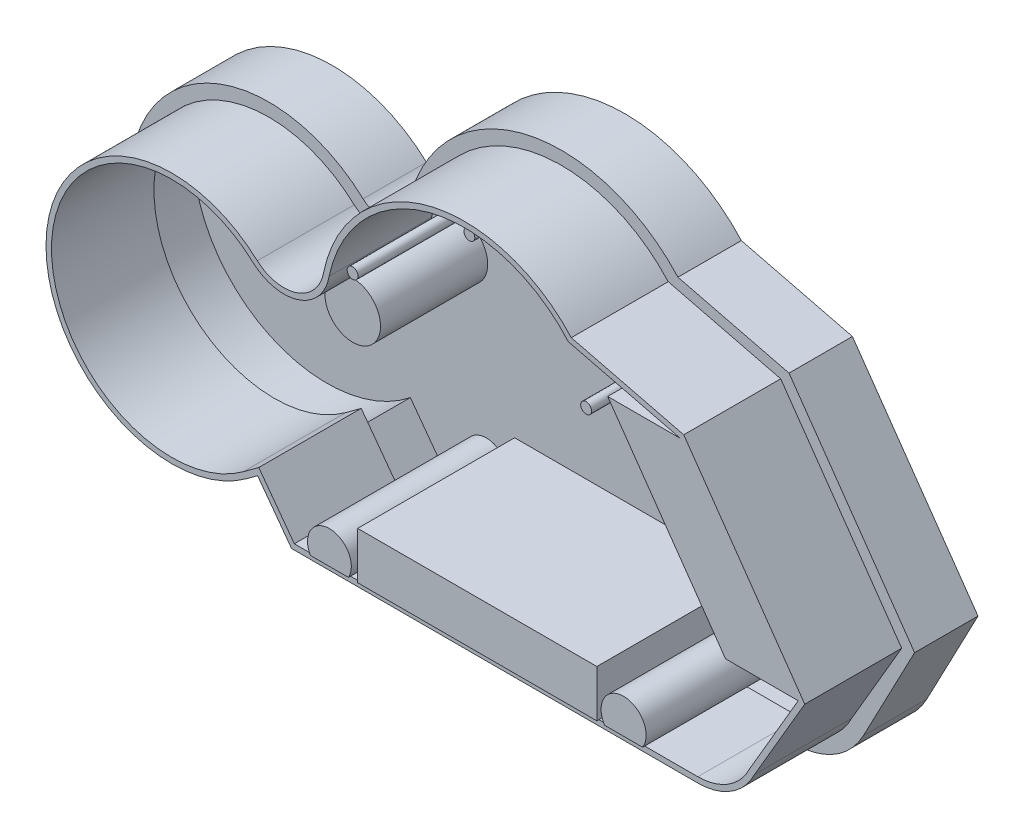
from build123d import *

# Parameters (mm, degrees)
SKETCH1_W           = 300
SKETCH1_H           = 152
BOSS_EXTRUDE1_DEPTH = 61.3
CUT_EXTRUDE1_DEPTH  = 342.850391253
CUT_EXTRUDE2_DEPTH  = 37.06
SHELL2_START        = 2.1
SHELL2_DEPTH        = 59.2
SHELL2_2_DEPTH      = 20.04
BOSS_EXTRUDE3_DEPTH = 59.06
SKETCH10_R          = 2.075
BOSS_EXTRUDE4_DEPTH = 55
SKETCH11_R          = 10.625
BOSS_EXTRUDE7_DEPTH = 41
SKETCH12_W          = 91.45
SKETCH12_H          = 18
BOSS_EXTRUDE8_DEPTH = 60


# Read off the part's stored shape, not the designer's step: Shell2
with BuildPart() as part:
    # Sketch1 → Boss-Extrude1 (new body)
    with BuildSketch(Plane.XY):
        with Locations((150, -76)):
            Rectangle(SKETCH1_W, SKETCH1_H)
    extrude(amount=BOSS_EXTRUDE1_DEPTH)

    # Sketch2 → Cut-Extrude1 (cut, through all)
    with BuildSketch(Plane.XY.offset(61.3)):
        with BuildLine():
            ThreePointArc((106.276631817, -47.688784415), (127.175886892, -13.423863754), (165, 0))
            Line((165, 0), (0, 0))
            Line((0, 0), (0, -152))
            Line((0, -152), (96.53, -152))
            Line((96.53, -152), (84.669267872, -135.896130578))
            ThreePointArc((84.669267872, -135.896130578), (0.080288741, -90.185905943), (89.166858478, -54.015432913))
            ThreePointArc((89.166858478, -54.015432913), (99.658448556, -56.089724813), (106.276631817, -47.688784415))
        make_face()
        with BuildLine():
            Line((209.523701897, -19.780104806), (251.991652277, -30.293700311))
            Line((251.991652277, -30.293700311), (300, -98.856726418))
            Line((300, -98.856726418), (300, 0))
            Line((300, 0), (165, 0))
            ThreePointArc((165, 0), (189.359867491, -5.16755654), (209.523701897, -19.780104806))
        make_face()
        with BuildLine():
            Line((300, -152), (300, -98.856726418))
            Line((300, -98.856726418), (280.413634666, -136.151905638))
            ThreePointArc((280.413634666, -136.151905638), (269.510257097, -147.730229239), (254.19, -152))
            Line((254.19, -152), (300, -152))
        make_face()
    extrude(amount=-CUT_EXTRUDE1_DEPTH, mode=Mode.SUBTRACT)

    # Sketch3 → Cut-Extrude2 (cut)
    with BuildSketch(Plane.XY.offset(61.3)):
        with BuildLine():
            ThreePointArc((105.977880822, -49.211605878), (98.92047416, -56.331219446), (89.166858478, -54.015432913))
            ThreePointArc((89.166858478, -54.015432913), (0.080288741, -90.185905943), (84.669267872, -135.896130578))
            Line((84.669267872, -135.896130578), (96.53, -152))
            Line((96.53, -152), (254.19, -152))
            ThreePointArc((254.19, -152), (269.510257097, -147.730229239), (280.413634666, -136.151905638))
            Line((280.413634666, -136.151905638), (300, -98.856726418))
            Line((300, -98.856726418), (251.991652277, -30.293700311))
            Line((251.991652277, -30.293700311), (209.523701897, -19.780104806))
            ThreePointArc((209.523701897, -19.780104806), (149.343332729, -2.078770991), (106.276631817, -47.688784415))
            ThreePointArc((106.276631817, -47.688784415), (106.15614248, -48.455862107), (105.977880822, -49.211605878))
        make_face()
        with BuildLine():
            ThreePointArc((111.170245832, -48.714719047), (150.648055001, -6.905540075), (205.813393405, -23.131762739))
            Line((205.813393405, -23.131762739), (248.805105887, -33.775023623))
            Line((248.805105887, -33.775023623), (295.06982456, -99.847889378))
            Line((295.06982456, -99.847889378), (275.848412222, -132.766220681))
            ThreePointArc((275.848412222, -132.766220681), (266.986159175, -142.707781738), (254.19, -146.4))
            Line((254.19, -146.4), (98.879937279, -146.4))
            Line((98.879937279, -146.4), (85.901779611, -128.778949784))
            Line((85.901779611, -128.778949784), (81.704299385, -131.870454519))
            ThreePointArc((81.704299385, -131.870454519), (5.072473907, -90.460119595), (85.77880864, -57.692146685))
            ThreePointArc((85.77880864, -57.692146685), (101.106669521, -60.648090535), (111.170245832, -48.714719047))
        make_face(mode=Mode.SUBTRACT)
    extrude(amount=-CUT_EXTRUDE2_DEPTH, mode=Mode.SUBTRACT)

    # Shell2 outline → Shell2 (cut)
    with BuildSketch(Plane.XY.offset(SHELL2_START)):
        with BuildLine():
            Line((99.941363565, -144.3), (254.19, -144.3))
            ThreePointArc((254.19, -144.3), (265.902746491, -140.908301855), (273.990848772, -131.782807449))
            Line((273.990848772, -131.782807449), (292.5780859, -99.950556049))
            Line((292.5780859, -99.950556049), (247.536374557, -35.624325774))
            Line((247.536374557, -35.624325774), (204.678827772, -25.014279675))
            ThreePointArc((204.678827772, -25.014279675), (151.521188692, -8.846000687), (113.233094528, -49.109752168))
            ThreePointArc((113.233094528, -49.109752168), (101.775664547, -62.638918954), (84.37325412, -59.25259838))
            ThreePointArc((84.37325412, -59.25259838), (7.169967657, -90.563406667), (80.458940533, -130.179572699))
            Line((80.458940533, -130.179572699), (86.34730258, -125.842709112))
            Line((86.34730258, -125.842709112), (99.941363565, -144.3))
        make_face()
    extrude(amount=SHELL2_DEPTH, mode=Mode.SUBTRACT)

    # Shell2 2 outline → Shell2 2 (cut)
    with BuildSketch(Plane.XY.offset(SHELL2_START)):
        with BuildLine():
            Line((97.591426286, -149.9), (254.19, -149.9))
            ThreePointArc((254.19, -149.9), (268.424080868, -145.932947626), (278.554430318, -135.175504495))
            Line((278.554430318, -135.175504495), (297.545882937, -99.013122297))
            Line((297.545882937, -99.013122297), (250.722920948, -32.143002462))
            Line((250.722920948, -32.143002462), (208.389700931, -21.662761535))
            ThreePointArc((208.389700931, -21.662761535), (150.241547582, -4.012518522), (108.350090196, -48.033475058))
            ThreePointArc((108.350090196, -48.033475058), (100.340566871, -58.076361401), (87.743795173, -55.559742089))
            ThreePointArc((87.743795173, -55.559742089), (2.130315246, -91.350316403), (85.089165222, -132.925096807))
            Line((85.089165222, -132.925096807), (97.591426286, -149.9))
        make_face()
        with BuildLine():
            ThreePointArc((273.990848772, -131.782807449), (265.902746491, -140.908301855), (254.19, -144.3))
            Line((254.19, -144.3), (99.941363565, -144.3))
            Line((99.941363565, -144.3), (86.34730258, -125.842709112))
            Line((86.34730258, -125.842709112), (80.458940533, -130.179572699))
            ThreePointArc((80.458940533, -130.179572699), (7.169967657, -90.563406667), (84.37325412, -59.25259838))
            ThreePointArc((84.37325412, -59.25259838), (101.775664547, -62.638918954), (113.233094528, -49.109752168))
            ThreePointArc((113.233094528, -49.109752168), (151.521188692, -8.846000687), (204.678827772, -25.014279675))
            Line((204.678827772, -25.014279675), (247.536374557, -35.624325774))
            Line((247.536374557, -35.624325774), (292.5780859, -99.950556049))
            Line((292.5780859, -99.950556049), (273.990848772, -131.782807449))
        make_face(mode=Mode.SUBTRACT)
    extrude(amount=SHELL2_2_DEPTH, mode=Mode.SUBTRACT)

    # Sketch9 → Boss-Extrude3 (add)
    with BuildSketch(Plane.XY.offset(61.3)):
        Polygon((247.536374557, -35.624325774), (219.726374557, -35.624325774), (264.7680859, -99.950556049), (292.5780859, -99.950556049), (248.135467364, -36.479918971), align=None)
    extrude(amount=-BOSS_EXTRUDE3_DEPTH)

    # Sketch10 → Boss-Extrude4 (add)
    with BuildSketch(Plane.XY.offset(2.1)):
        with Locations((118, -47.741938271)):
            Circle(SKETCH10_R)
        with Locations((207.29, -47.741938271)):
            Circle(SKETCH10_R)
        with Locations((162.650383795, -12.633773594)):
            Circle(SKETCH10_R)
    extrude(amount=BOSS_EXTRUDE4_DEPTH)

    # Sketch11 → Boss-Extrude7 (add)
    with BuildSketch(Plane.XY.offset(2.1)):
        with Locations((104.050993742, -74.01432733)):
            Circle(SKETCH11_R)
    extrude(amount=BOSS_EXTRUDE7_DEPTH)

    # Sketch12 → Boss-Extrude8 (add)
    with BuildSketch(Plane.XY.offset(2.1)):
        with Locations((170.666363565, -135.3)):
            Rectangle(SKETCH12_W, SKETCH12_H)
        with BuildLine():
            Line((106.891363565, -144.3), (121.411363565, -144.3))
            ThreePointArc((121.411363565, -144.3), (114.151363565, -131.75824963), (106.891363565, -144.3))
        make_face()
        with BuildLine():
            Line((219.350413724, -144.3), (233.870413724, -144.3))
            ThreePointArc((233.870413724, -144.3), (226.610413724, -131.046495008), (219.350413724, -144.3))
        make_face()
    extrude(amount=BOSS_EXTRUDE8_DEPTH)


solid = part.part
